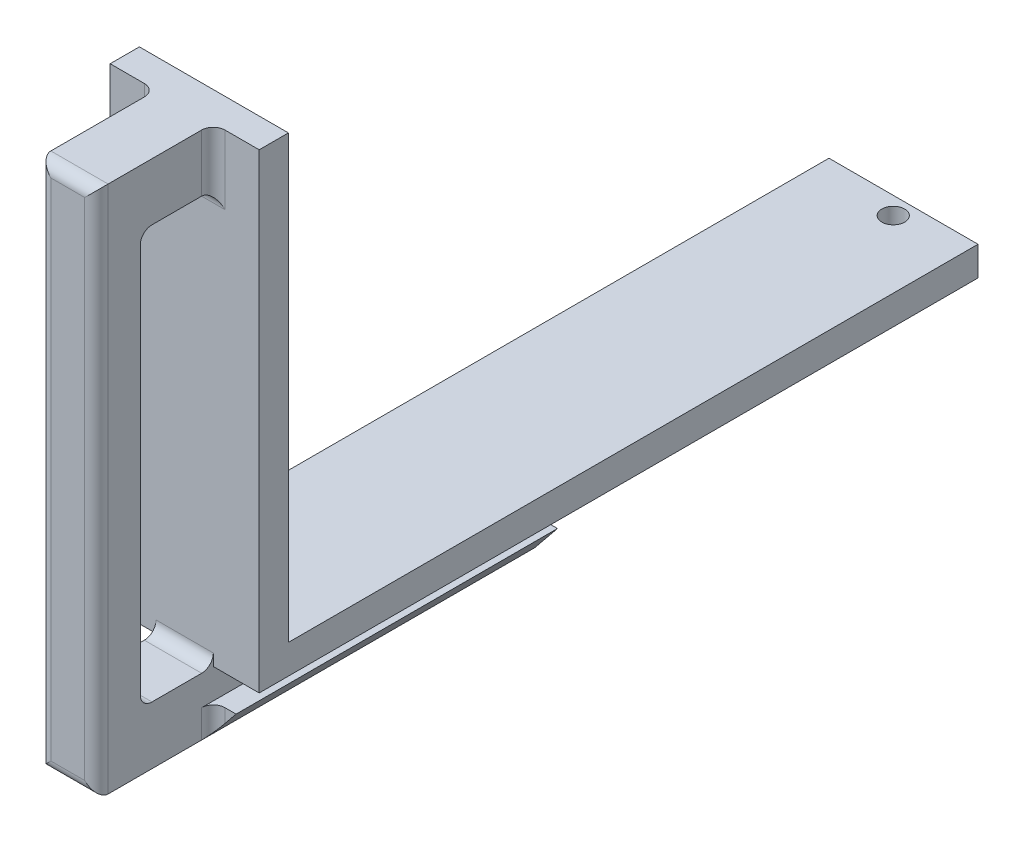
from build123d import *

# Parameters (mm, degrees)
SKETCH1_W            = 25.5
SKETCH1_H            = 118
BOSS_EXTRUDE1_DEPTH  = 5
BOSS_EXTRUDE5_DEPTH  = 50
SKETCH2_R            = 1.95
CUT_EXTRUDE1_DEPTH   = 10
BOSS_EXTRUDE7_DEPTH  = 5
BOSS_EXTRUDE8_DEPTH  = 80.5
SKETCH9_W            = 9.8
SKETCH9_H            = 9.8
SKETCH9_H_2          = 9.9
BOSS_EXTRUDE10_DEPTH = 12.5
SKETCH10_W           = 9.8
SKETCH10_H           = 90.4
BOSS_EXTRUDE11_DEPTH = 7.5
FILLET1_R            = 2


with BuildPart() as part:
    # Sketch1 → Boss-Extrude1 (new body)
    with BuildSketch(Plane(origin=(0, 0, 0), x_dir=(1, 0, 0), z_dir=(0, 1, 0))):
        Rectangle(SKETCH1_W, SKETCH1_H)
    extrude(amount=BOSS_EXTRUDE1_DEPTH)

    # Sketch5 → Boss-Extrude5 (add)
    with BuildSketch(Plane.XY.offset(59)):
        Polygon((-4.9, 0), (-4.9, -5.1), (-8.8, -5.1), (-4.9, -9.9), (4.9, -9.9), (8.8, -5.1), (4.9, -5.1), (4.9, 0), align=None)
    extrude(amount=-BOSS_EXTRUDE5_DEPTH)

    # Sketch2 → Cut-Extrude1 (cut)
    with BuildSketch(Plane(origin=(0, 5, 0), x_dir=(1, 0, 0), z_dir=(0, 1, 0))):
        with Locations(Location((1.25, 56, 0), (0, 0, 270))):
            Circle(SKETCH2_R)
        with Locations(Location((1.25, -56, 0), (0, 0, 270))):
            Circle(SKETCH2_R)
    extrude(amount=-CUT_EXTRUDE1_DEPTH, mode=Mode.SUBTRACT)

    # Sketch5<4> → Boss-Extrude7 (add)
    with BuildSketch(Plane.XY.offset(59)):
        Polygon((-4.9, 0), (-4.9, -5.1), (-8.8, -5.1), (-4.9, -9.9), (4.9, -9.9), (8.8, -5.1), (4.9, -5.1), (4.9, 0), align=None)
    extrude(amount=BOSS_EXTRUDE7_DEPTH)

    # Sketch8 → Boss-Extrude8 (add)
    with BuildSketch(Plane(origin=(0, 0, 0), x_dir=(1, 0, 0), z_dir=(0, 1, 0))):
        Polygon((-4.9, -64), (12.75, -64), (12.75, -59), (-4.9, -59), (-12.75, -59), (-12.75, -64), align=None)
    extrude(amount=BOSS_EXTRUDE8_DEPTH)

    # Sketch9 → Boss-Extrude10 (add)
    with BuildSketch(Plane.XY.offset(64)):
        with Locations((0, 75.6)):
            Rectangle(SKETCH9_W, SKETCH9_H)
        with Locations((0, -4.95)):
            Rectangle(SKETCH9_W, SKETCH9_H_2)
    extrude(amount=BOSS_EXTRUDE10_DEPTH)

    # Sketch10 → Boss-Extrude11 (add)
    with BuildSketch(Plane.XY.offset(76.5)):
        with Locations((0, 35.3)):
            Rectangle(SKETCH10_W, SKETCH10_H)
    extrude(amount=BOSS_EXTRUDE11_DEPTH)

    # Fillet1
    # the kernel refuses this fillet: 2 mm, written as the material it adds along each edge
    with BuildSketch(Plane(origin=(4.9, -9.9, 64), x_dir=(0, 0, 1), z_dir=(0, 1, 0))) as fillet1_piece_1_section:
        with BuildLine():
            CenterArc((FILLET1_R, FILLET1_R), FILLET1_R, 180, 90)
            Line((0, FILLET1_R), (-FILLET1_R * 0.02, FILLET1_R))
            Line((-FILLET1_R * 0.02, FILLET1_R), (-FILLET1_R * 0.02, -FILLET1_R * 0.02))
            Line((-FILLET1_R * 0.02, -FILLET1_R * 0.02), (FILLET1_R, -FILLET1_R * 0.02))
            Line((FILLET1_R, -FILLET1_R * 0.02), (FILLET1_R, 0))
        make_face()
    fillet1_piece_1 = extrude(amount=4.8, mode=Mode.PRIVATE)
    fillet1_piece_1 = split(fillet1_piece_1, bisect_by=Plane(origin=(6.354004959, -8.110455435, 64.484419844), z_dir=(-0.7761140001162659, 0.6305926250944655, 0)), keep=Keep.TOP, mode=Mode.PRIVATE)
    add(fillet1_piece_1)
    with BuildSketch(Plane(origin=(4.9, 0, 64), x_dir=(0, 0, 1), z_dir=(-1, 0, 0))) as fillet1_piece_2_section:
        with BuildLine():
            CenterArc((FILLET1_R, FILLET1_R), FILLET1_R, 180, 90)
            Line((0, FILLET1_R), (-FILLET1_R * 0.02, FILLET1_R))
            Line((-FILLET1_R * 0.02, FILLET1_R), (-FILLET1_R * 0.02, -FILLET1_R * 0.02))
            Line((-FILLET1_R * 0.02, -FILLET1_R * 0.02), (FILLET1_R, -FILLET1_R * 0.02))
            Line((FILLET1_R, -FILLET1_R * 0.02), (FILLET1_R, 0))
        make_face()
    fillet1_piece_2 = extrude(amount=9.8, mode=Mode.PRIVATE)
    fillet1_piece_2 = split(fillet1_piece_2, bisect_by=Plane(origin=(0, 0, 64.406946259), z_dir=(0, 1, 0)), keep=Keep.TOP, mode=Mode.PRIVATE)
    add(fillet1_piece_2)
    with BuildSketch(Plane(origin=(4.9, 0, 76.5), x_dir=(0, 0, -1), z_dir=(-1, 0, 0))) as fillet1_piece_3:
        with BuildLine():
            CenterArc((FILLET1_R, -FILLET1_R), FILLET1_R, 90, 90)
            Line((0, -FILLET1_R), (-FILLET1_R * 0.02, -FILLET1_R))
            Line((-FILLET1_R * 0.02, -FILLET1_R), (-FILLET1_R * 0.02, FILLET1_R * 0.02))
            Line((-FILLET1_R * 0.02, FILLET1_R * 0.02), (FILLET1_R, FILLET1_R * 0.02))
            Line((FILLET1_R, FILLET1_R * 0.02), (FILLET1_R, 0))
        make_face()
    extrude(amount=9.8)
    with BuildSketch(Plane(origin=(4.9, 70.7, 64), x_dir=(0, 0, 1), z_dir=(0, 1, 0)), Plane(origin=(-4.9, 80.5, 64), x_dir=(0, 0, 1), z_dir=(0, -1, 0)), Plane(origin=(-4.9, 70.7, 64), x_dir=(0, 0, 1), z_dir=(1, 0, 0)), Plane(origin=(-4.9, 70.7, 76.5), x_dir=(0, -1, 0), z_dir=(1, 0, 0))) as fillet1_piece_4:
        with BuildLine():
            CenterArc((FILLET1_R, FILLET1_R), FILLET1_R, 180, 90)
            Line((0, FILLET1_R), (-FILLET1_R * 0.02, FILLET1_R))
            Line((-FILLET1_R * 0.02, FILLET1_R), (-FILLET1_R * 0.02, -FILLET1_R * 0.02))
            Line((-FILLET1_R * 0.02, -FILLET1_R * 0.02), (FILLET1_R, -FILLET1_R * 0.02))
            Line((FILLET1_R, -FILLET1_R * 0.02), (FILLET1_R, 0))
        make_face()
    extrude(amount=9.8)
    with BuildSketch(Plane(origin=(-4.9, -5.1, 64), x_dir=(-1, 0, 0), z_dir=(0, -1, 0))) as fillet1_piece_5_section:
        with BuildLine():
            CenterArc((FILLET1_R, -FILLET1_R), FILLET1_R, 90, 90)
            Line((0, -FILLET1_R), (-FILLET1_R * 0.02, -FILLET1_R))
            Line((-FILLET1_R * 0.02, -FILLET1_R), (-FILLET1_R * 0.02, FILLET1_R * 0.02))
            Line((-FILLET1_R * 0.02, FILLET1_R * 0.02), (FILLET1_R, FILLET1_R * 0.02))
            Line((FILLET1_R, FILLET1_R * 0.02), (FILLET1_R, 0))
        make_face()
    fillet1_piece_5 = extrude(amount=4.8, mode=Mode.PRIVATE)
    fillet1_piece_5 = split(fillet1_piece_5, bisect_by=Plane(origin=(-6.354004959, -8.110455435, 64.484419844), z_dir=(0.7761140001162656, 0.6305926250944656, 0)), keep=Keep.TOP, mode=Mode.PRIVATE)
    add(fillet1_piece_5)
    with BuildSketch(Plane(origin=(4.9, 65.7, 64), x_dir=(0, 0, 1), z_dir=(0, 1, 0))) as fillet1_piece_6a_section:
        with BuildLine():
            CenterArc((FILLET1_R, FILLET1_R), FILLET1_R, 180, 90)
            Line((0, FILLET1_R), (-FILLET1_R * 0.02, FILLET1_R))
            Line((-FILLET1_R * 0.02, FILLET1_R), (-FILLET1_R * 0.02, -FILLET1_R * 0.02))
            Line((-FILLET1_R * 0.02, -FILLET1_R * 0.02), (FILLET1_R, -FILLET1_R * 0.02))
            Line((FILLET1_R, -FILLET1_R * 0.02), (FILLET1_R, 0))
        make_face()
    fillet1_piece_6a = extrude(amount=14.8, mode=Mode.PRIVATE)
    fillet1_piece_6a = split(fillet1_piece_6a, bisect_by=Plane(origin=(5.352790229, 70.7, 64.452790229), z_dir=(0, -1, 0)), keep=Keep.TOP, mode=Mode.PRIVATE)
    with BuildSketch(Plane(origin=(-4.9, 70.7, 64), x_dir=(0, 0, 1), z_dir=(1, 0, 0))) as fillet1_piece_6b_section:
        with BuildLine():
            CenterArc((FILLET1_R, FILLET1_R), FILLET1_R, 180, 90)
            Line((0, FILLET1_R), (-FILLET1_R * 0.02, FILLET1_R))
            Line((-FILLET1_R * 0.02, FILLET1_R), (-FILLET1_R * 0.02, -FILLET1_R * 0.02))
            Line((-FILLET1_R * 0.02, -FILLET1_R * 0.02), (FILLET1_R, -FILLET1_R * 0.02))
            Line((FILLET1_R, -FILLET1_R * 0.02), (FILLET1_R, 0))
        make_face()
    fillet1_piece_6b = extrude(amount=14.8, mode=Mode.PRIVATE)
    fillet1_piece_6b = split(fillet1_piece_6b, bisect_by=Plane(origin=(4.9, 70.247209771, 64.452790229), z_dir=(1, 0, 0)), keep=Keep.TOP, mode=Mode.PRIVATE)
    fillet1_piece_6 = fillet1_piece_6a & fillet1_piece_6b
    add(fillet1_piece_6)
    with BuildSketch(Plane(origin=(-9.9, 70.7, 64), x_dir=(0, 0, 1), z_dir=(1, 0, 0))) as fillet1_piece_7a_section:
        with BuildLine():
            CenterArc((FILLET1_R, FILLET1_R), FILLET1_R, 180, 90)
            Line((0, FILLET1_R), (-FILLET1_R * 0.02, FILLET1_R))
            Line((-FILLET1_R * 0.02, FILLET1_R), (-FILLET1_R * 0.02, -FILLET1_R * 0.02))
            Line((-FILLET1_R * 0.02, -FILLET1_R * 0.02), (FILLET1_R, -FILLET1_R * 0.02))
            Line((FILLET1_R, -FILLET1_R * 0.02), (FILLET1_R, 0))
        make_face()
    fillet1_piece_7a = extrude(amount=14.8, mode=Mode.PRIVATE)
    fillet1_piece_7a = split(fillet1_piece_7a, bisect_by=Plane(origin=(-4.9, 70.247209771, 64.452790229), z_dir=(-1, 0, 0)), keep=Keep.TOP, mode=Mode.PRIVATE)
    with BuildSketch(Plane(origin=(-4.9, 80.5, 64), x_dir=(0, 0, 1), z_dir=(0, -1, 0))) as fillet1_piece_7b_section:
        with BuildLine():
            CenterArc((FILLET1_R, FILLET1_R), FILLET1_R, 180, 90)
            Line((0, FILLET1_R), (-FILLET1_R * 0.02, FILLET1_R))
            Line((-FILLET1_R * 0.02, FILLET1_R), (-FILLET1_R * 0.02, -FILLET1_R * 0.02))
            Line((-FILLET1_R * 0.02, -FILLET1_R * 0.02), (FILLET1_R, -FILLET1_R * 0.02))
            Line((FILLET1_R, -FILLET1_R * 0.02), (FILLET1_R, 0))
        make_face()
    fillet1_piece_7b = extrude(amount=14.8, mode=Mode.PRIVATE)
    fillet1_piece_7b = split(fillet1_piece_7b, bisect_by=Plane(origin=(-5.352790229, 70.7, 64.452790229), z_dir=(0, -1, 0)), keep=Keep.TOP, mode=Mode.PRIVATE)
    fillet1_piece_7 = fillet1_piece_7a & fillet1_piece_7b
    add(fillet1_piece_7)
    # the kernel refuses this fillet: 2 mm, written as the material it takes off along each edge
    with BuildSketch(Plane(origin=(-4.9, -9.9, 84), x_dir=(1, 0, 0), z_dir=(0, 1, 0))) as fillet1_2_piece_1:
        with BuildLine():
            CenterArc((FILLET1_R, FILLET1_R), FILLET1_R, 180, 90)
            Line((0, FILLET1_R), (-FILLET1_R * 0.02, FILLET1_R))
            Line((-FILLET1_R * 0.02, FILLET1_R), (-FILLET1_R * 0.02, -FILLET1_R * 0.02))
            Line((-FILLET1_R * 0.02, -FILLET1_R * 0.02), (FILLET1_R, -FILLET1_R * 0.02))
            Line((FILLET1_R, -FILLET1_R * 0.02), (FILLET1_R, 0))
        make_face()
    extrude(amount=90.4, mode=Mode.SUBTRACT)
    with BuildSketch(Plane(origin=(4.9, -9.9, 84), x_dir=(0, 1, 0), z_dir=(-1, 0, 0)), Plane(origin=(-4.9, 80.5, 84), x_dir=(0, -1, 0), z_dir=(1, 0, 0))) as fillet1_2_piece_2:
        with BuildLine():
            CenterArc((FILLET1_R, FILLET1_R), FILLET1_R, 180, 90)
            Line((0, FILLET1_R), (-FILLET1_R * 0.02, FILLET1_R))
            Line((-FILLET1_R * 0.02, FILLET1_R), (-FILLET1_R * 0.02, -FILLET1_R * 0.02))
            Line((-FILLET1_R * 0.02, -FILLET1_R * 0.02), (FILLET1_R, -FILLET1_R * 0.02))
            Line((FILLET1_R, -FILLET1_R * 0.02), (FILLET1_R, 0))
        make_face()
    extrude(amount=9.8, mode=Mode.SUBTRACT)
    with BuildSketch(Plane(origin=(4.9, 80.5, 84), x_dir=(0, 0, -1), z_dir=(0, -1, 0))) as fillet1_2_piece_3:
        with BuildLine():
            CenterArc((FILLET1_R, -FILLET1_R), FILLET1_R, 90, 90)
            Line((0, -FILLET1_R), (-FILLET1_R * 0.02, -FILLET1_R))
            Line((-FILLET1_R * 0.02, -FILLET1_R), (-FILLET1_R * 0.02, FILLET1_R * 0.02))
            Line((-FILLET1_R * 0.02, FILLET1_R * 0.02), (FILLET1_R, FILLET1_R * 0.02))
            Line((FILLET1_R, FILLET1_R * 0.02), (FILLET1_R, 0))
        make_face()
    extrude(amount=90.4, mode=Mode.SUBTRACT)
    with BuildSketch(Plane(origin=(4.9, -9.9, 84), x_dir=(0, 1, 0), z_dir=(-1, 0, 0))) as fillet1_2_piece_4a_section:
        with BuildLine():
            CenterArc((FILLET1_R, FILLET1_R), FILLET1_R, 180, 90)
            Line((0, FILLET1_R), (-FILLET1_R * 0.02, FILLET1_R))
            Line((-FILLET1_R * 0.02, FILLET1_R), (-FILLET1_R * 0.02, -FILLET1_R * 0.02))
            Line((-FILLET1_R * 0.02, -FILLET1_R * 0.02), (FILLET1_R, -FILLET1_R * 0.02))
            Line((FILLET1_R, -FILLET1_R * 0.02), (FILLET1_R, 0))
        make_face()
    fillet1_2_piece_4a = extrude(amount=14.8, mode=Mode.PRIVATE)
    fillet1_2_piece_4a = split(fillet1_2_piece_4a, bisect_by=Plane(origin=(-4.9, -9.447209771, 83.547209771), z_dir=(-1, 0, 0)), keep=Keep.TOP, mode=Mode.PRIVATE)
    with BuildSketch(Plane(origin=(-4.9, -14.9, 84), x_dir=(1, 0, 0), z_dir=(0, 1, 0))) as fillet1_2_piece_4b_section:
        with BuildLine():
            CenterArc((FILLET1_R, FILLET1_R), FILLET1_R, 180, 90)
            Line((0, FILLET1_R), (-FILLET1_R * 0.02, FILLET1_R))
            Line((-FILLET1_R * 0.02, FILLET1_R), (-FILLET1_R * 0.02, -FILLET1_R * 0.02))
            Line((-FILLET1_R * 0.02, -FILLET1_R * 0.02), (FILLET1_R, -FILLET1_R * 0.02))
            Line((FILLET1_R, -FILLET1_R * 0.02), (FILLET1_R, 0))
        make_face()
    fillet1_2_piece_4b = extrude(amount=95.4, mode=Mode.PRIVATE)
    fillet1_2_piece_4b = split(fillet1_2_piece_4b, bisect_by=Plane(origin=(-4.447209771, -9.9, 83.547209771), z_dir=(0, -1, 0)), keep=Keep.TOP, mode=Mode.PRIVATE)
    fillet1_2_piece_4 = fillet1_2_piece_4a & fillet1_2_piece_4b
    add(fillet1_2_piece_4, mode=Mode.SUBTRACT)
    with BuildSketch(Plane(origin=(-4.9, -9.9, 84), x_dir=(1, 0, 0), z_dir=(0, 1, 0))) as fillet1_2_piece_5a_section:
        with BuildLine():
            CenterArc((FILLET1_R, FILLET1_R), FILLET1_R, 180, 90)
            Line((0, FILLET1_R), (-FILLET1_R * 0.02, FILLET1_R))
            Line((-FILLET1_R * 0.02, FILLET1_R), (-FILLET1_R * 0.02, -FILLET1_R * 0.02))
            Line((-FILLET1_R * 0.02, -FILLET1_R * 0.02), (FILLET1_R, -FILLET1_R * 0.02))
            Line((FILLET1_R, -FILLET1_R * 0.02), (FILLET1_R, 0))
        make_face()
    fillet1_2_piece_5a = extrude(amount=95.4, mode=Mode.PRIVATE)
    fillet1_2_piece_5a = split(fillet1_2_piece_5a, bisect_by=Plane(origin=(-4.447209771, 80.5, 83.547209771), z_dir=(0, 1, 0)), keep=Keep.TOP, mode=Mode.PRIVATE)
    with BuildSketch(Plane(origin=(-9.9, 80.5, 84), x_dir=(0, -1, 0), z_dir=(1, 0, 0))) as fillet1_2_piece_5b_section:
        with BuildLine():
            CenterArc((FILLET1_R, FILLET1_R), FILLET1_R, 180, 90)
            Line((0, FILLET1_R), (-FILLET1_R * 0.02, FILLET1_R))
            Line((-FILLET1_R * 0.02, FILLET1_R), (-FILLET1_R * 0.02, -FILLET1_R * 0.02))
            Line((-FILLET1_R * 0.02, -FILLET1_R * 0.02), (FILLET1_R, -FILLET1_R * 0.02))
            Line((FILLET1_R, -FILLET1_R * 0.02), (FILLET1_R, 0))
        make_face()
    fillet1_2_piece_5b = extrude(amount=14.8, mode=Mode.PRIVATE)
    fillet1_2_piece_5b = split(fillet1_2_piece_5b, bisect_by=Plane(origin=(-4.9, 80.047209771, 83.547209771), z_dir=(-1, 0, 0)), keep=Keep.TOP, mode=Mode.PRIVATE)
    fillet1_2_piece_5 = fillet1_2_piece_5a & fillet1_2_piece_5b
    add(fillet1_2_piece_5, mode=Mode.SUBTRACT)
    with BuildSketch(Plane(origin=(4.9, 80.5, 84), x_dir=(0, 0, -1), z_dir=(0, -1, 0))) as fillet1_2_piece_6a_section:
        with BuildLine():
            CenterArc((FILLET1_R, -FILLET1_R), FILLET1_R, 90, 90)
            Line((0, -FILLET1_R), (-FILLET1_R * 0.02, -FILLET1_R))
            Line((-FILLET1_R * 0.02, -FILLET1_R), (-FILLET1_R * 0.02, FILLET1_R * 0.02))
            Line((-FILLET1_R * 0.02, FILLET1_R * 0.02), (FILLET1_R, FILLET1_R * 0.02))
            Line((FILLET1_R, FILLET1_R * 0.02), (FILLET1_R, 0))
        make_face()
    fillet1_2_piece_6a = extrude(amount=95.4, mode=Mode.PRIVATE)
    fillet1_2_piece_6a = split(fillet1_2_piece_6a, bisect_by=Plane(origin=(4.447209771, -9.9, 83.547209771), z_dir=(0, -1, 0)), keep=Keep.TOP, mode=Mode.PRIVATE)
    with BuildSketch(Plane(origin=(9.9, -9.9, 84), x_dir=(0, 1, 0), z_dir=(-1, 0, 0))) as fillet1_2_piece_6b_section:
        with BuildLine():
            CenterArc((FILLET1_R, FILLET1_R), FILLET1_R, 180, 90)
            Line((0, FILLET1_R), (-FILLET1_R * 0.02, FILLET1_R))
            Line((-FILLET1_R * 0.02, FILLET1_R), (-FILLET1_R * 0.02, -FILLET1_R * 0.02))
            Line((-FILLET1_R * 0.02, -FILLET1_R * 0.02), (FILLET1_R, -FILLET1_R * 0.02))
            Line((FILLET1_R, -FILLET1_R * 0.02), (FILLET1_R, 0))
        make_face()
    fillet1_2_piece_6b = extrude(amount=14.8, mode=Mode.PRIVATE)
    fillet1_2_piece_6b = split(fillet1_2_piece_6b, bisect_by=Plane(origin=(4.9, -9.447209771, 83.547209771), z_dir=(1, 0, 0)), keep=Keep.TOP, mode=Mode.PRIVATE)
    fillet1_2_piece_6 = fillet1_2_piece_6a & fillet1_2_piece_6b
    add(fillet1_2_piece_6, mode=Mode.SUBTRACT)
    with BuildSketch(Plane(origin=(4.9, 85.5, 84), x_dir=(0, 0, -1), z_dir=(0, -1, 0))) as fillet1_2_piece_7a_section:
        with BuildLine():
            CenterArc((FILLET1_R, -FILLET1_R), FILLET1_R, 90, 90)
            Line((0, -FILLET1_R), (-FILLET1_R * 0.02, -FILLET1_R))
            Line((-FILLET1_R * 0.02, -FILLET1_R), (-FILLET1_R * 0.02, FILLET1_R * 0.02))
            Line((-FILLET1_R * 0.02, FILLET1_R * 0.02), (FILLET1_R, FILLET1_R * 0.02))
            Line((FILLET1_R, FILLET1_R * 0.02), (FILLET1_R, 0))
        make_face()
    fillet1_2_piece_7a = extrude(amount=95.4, mode=Mode.PRIVATE)
    fillet1_2_piece_7a = split(fillet1_2_piece_7a, bisect_by=Plane(origin=(4.447209771, 80.5, 83.547209771), z_dir=(0, 1, 0)), keep=Keep.TOP, mode=Mode.PRIVATE)
    with BuildSketch(Plane(origin=(-4.9, 80.5, 84), x_dir=(0, -1, 0), z_dir=(1, 0, 0))) as fillet1_2_piece_7b_section:
        with BuildLine():
            CenterArc((FILLET1_R, FILLET1_R), FILLET1_R, 180, 90)
            Line((0, FILLET1_R), (-FILLET1_R * 0.02, FILLET1_R))
            Line((-FILLET1_R * 0.02, FILLET1_R), (-FILLET1_R * 0.02, -FILLET1_R * 0.02))
            Line((-FILLET1_R * 0.02, -FILLET1_R * 0.02), (FILLET1_R, -FILLET1_R * 0.02))
            Line((FILLET1_R, -FILLET1_R * 0.02), (FILLET1_R, 0))
        make_face()
    fillet1_2_piece_7b = extrude(amount=14.8, mode=Mode.PRIVATE)
    fillet1_2_piece_7b = split(fillet1_2_piece_7b, bisect_by=Plane(origin=(4.9, 80.047209771, 83.547209771), z_dir=(1, 0, 0)), keep=Keep.TOP, mode=Mode.PRIVATE)
    fillet1_2_piece_7 = fillet1_2_piece_7a & fillet1_2_piece_7b
    add(fillet1_2_piece_7, mode=Mode.SUBTRACT)


solid = part.part
